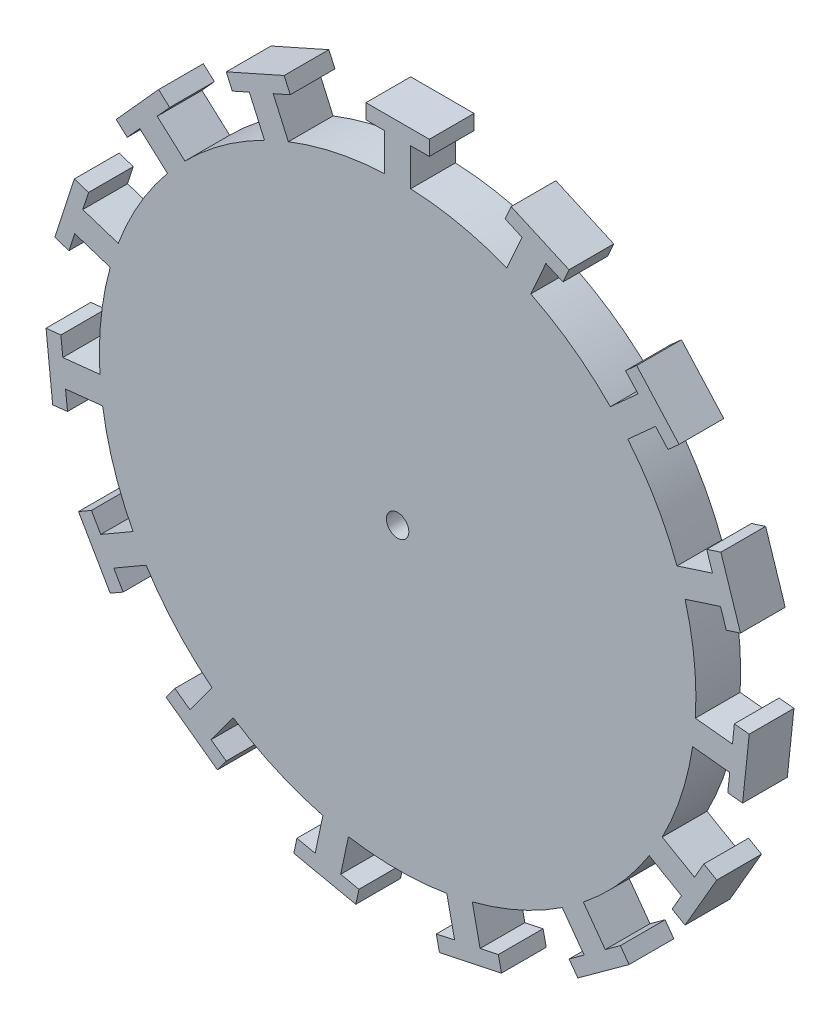
from build123d import *
from build123d.topology import SkipClean

# Parameters (mm, degrees)
SKETCH1_R           = 40
BOSS_EXTRUDE1_DEPTH = 2
BOSS_EXTRUDE2_DEPTH = 6
CIRPATTERN1_COUNT   = 15
SKETCH7_R           = 1.5
CUT_EXTRUDE1_DEPTH  = 10


with BuildPart() as part:
    # Sketch1 → Boss-Extrude1 (new body)
    with BuildSketch(Plane.XY):
        Circle(SKETCH1_R)
    extrude(amount=BOSS_EXTRUDE1_DEPTH)

    # Sketch6 → Boss-Extrude2 (add)
    with SkipClean():  # the faces are left unmerged after this step: merging them gives an invalid solid
        with BuildSketch(Plane.XY):
            with BuildLine():
                Line((-1.75, 39.961700414), (-1.75, 44.961700414))
                Line((-1.75, 44.961700414), (-4.25, 44.961700414))
                Line((-4.25, 44.961700414), (-4.25, 46.961700414))
                Line((-4.25, 46.961700414), (4.25, 46.961700414))
                Line((4.25, 46.961700414), (4.25, 44.961700414))
                Line((4.25, 44.961700414), (1.75, 44.961700414))
                Line((1.75, 44.961700414), (1.75, 39.961700414))
                ThreePointArc((1.75, 39.961700414), (0, -40), (-1.75, 39.961700414))
            make_face()
        boss_extrude2 = extrude(amount=BOSS_EXTRUDE2_DEPTH)

    # CirPattern1: Boss-Extrude2 ×15 about axis
    cirpattern1_axis = Axis((0, 0, 6), (0, 0, 1))
    for i in range(1, CIRPATTERN1_COUNT):
        add(boss_extrude2.rotate(cirpattern1_axis, i * 360 / CIRPATTERN1_COUNT))

    # Sketch7 → Cut-Extrude1 (cut)
    with BuildSketch(Plane.XY.offset(6)):
        Circle(SKETCH7_R)
    extrude(amount=-CUT_EXTRUDE1_DEPTH, mode=Mode.SUBTRACT)


solid = part.part
